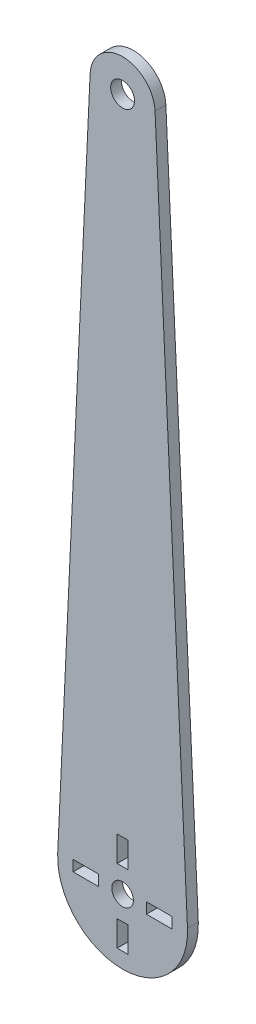
from build123d import *

# Parameters (mm, degrees)
SKETCH1_R           = 3.175
SKETCH1_R_2         = 3.5
SKETCH1_W           = 3.175
SKETCH1_H           = 7.5
SKETCH1_W_2         = 7.5
SKETCH1_H_2         = 3.175
BOSS_EXTRUDE1_DEPTH = 3.175


with BuildPart() as part:
    # Sketch1 → Boss-Extrude1 (new body)
    with BuildSketch(Plane.XY):
        with BuildLine():
            Line((-19.029105522, 0.891988246), (-9.525, 203.646483837))
            ThreePointArc((-9.525, 203.646483837), (0, 212.73545871), (9.525, 203.646483837))
            Line((9.525, 203.646483837), (19.029105522, 0.891988246))
            ThreePointArc((19.029105522, 0.891988246), (0, -19.05), (-19.029105522, 0.891988246))
        make_face()
        Circle(SKETCH1_R, mode=Mode.SUBTRACT)
        with Locations((0, 203.2)):
            Circle(SKETCH1_R_2, mode=Mode.SUBTRACT)
        with Locations((0, 10.75)):
            Rectangle(SKETCH1_W, SKETCH1_H, mode=Mode.SUBTRACT)
        with Locations((10.75, 0)):
            Rectangle(SKETCH1_W_2, SKETCH1_H_2, mode=Mode.SUBTRACT)
        with Locations((0, -10.75)):
            Rectangle(SKETCH1_W, SKETCH1_H, mode=Mode.SUBTRACT)
        with Locations((-10.75, 0)):
            Rectangle(SKETCH1_W_2, SKETCH1_H_2, mode=Mode.SUBTRACT)
    extrude(amount=BOSS_EXTRUDE1_DEPTH)


solid = part.part
